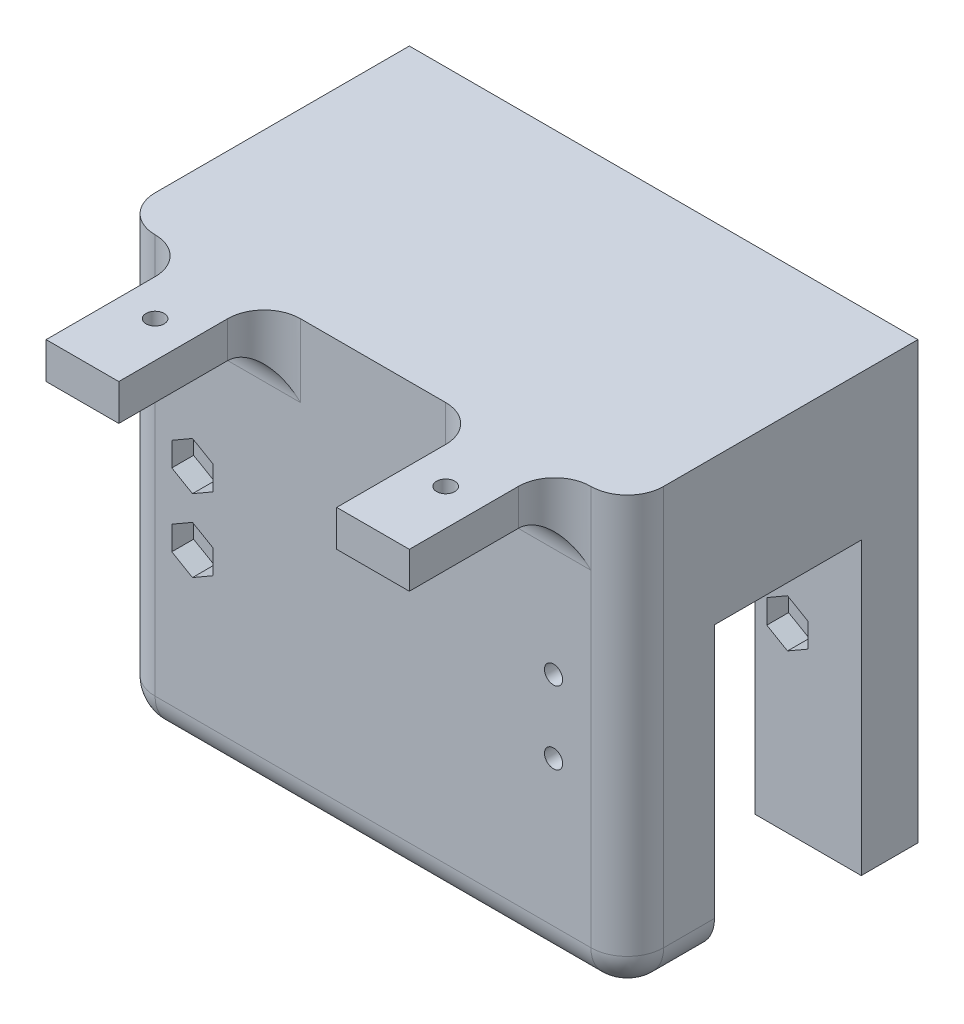
from build123d import *

# Parameters (mm, degrees)
SKETCH_2_W           = 70
SKETCH_2_H           = 60
EXTRUDE_2_DEPTH      = 40
SKETCH_3_W           = 40.7
SKETCH_3_H           = 20.5
CUT_EXTRUDE_1_DEPTH  = 28
SKETCH_4_W           = 14.65
SKETCH_4_H           = 20.5
EXTRUDE_3_DEPTH      = 28
SKETCH_8_W           = 10
SKETCH_8_H           = 5
EXTRUDE_5_DEPTH      = 60
SKETCH_15_W          = 40.7
SKETCH_15_H          = 40.25
CUT_EXTRUDE_6_DEPTH  = 28
SKETCH_16_W          = 14.65
SKETCH_16_H          = 20.204149113
CUT_EXTRUDE_7_DEPTH  = 40
M3X0_5_1_D           = 2.5
FILLET_1_R           = 5
FILLET_2_R           = 5
FILLET_3_R           = 5
M3X0_5_2_D           = 2.5
CUT_EXTRUDE_8_DEPTH  = 3
CUT_EXTRUDE_9_DEPTH  = 3
CUT_EXTRUDE_10_DEPTH = 6


# Some blends are built 0.0001 mm under size
with BuildPart() as part:
    # ｽｹｯﾁ2 → ﾎﾞｽ - 押し出し2 (new body)
    with BuildSketch(Plane.XY):
        Rectangle(SKETCH_2_W, SKETCH_2_H)
    extrude(amount=EXTRUDE_2_DEPTH)

    # ｽｹｯﾁ3 → ｶｯﾄ - 押し出し1 (cut)
    with BuildSketch(Plane.XY):
        Rectangle(SKETCH_3_W, SKETCH_3_H)
    extrude(amount=CUT_EXTRUDE_1_DEPTH, mode=Mode.SUBTRACT)

    # ｽｹｯﾁ4 → ﾎﾞｽ - 押し出し3 (add)
    with BuildSketch(Plane.XY):
        with Locations((27.675, 0)):
            Rectangle(SKETCH_4_W, SKETCH_4_H)
    extrude(amount=EXTRUDE_3_DEPTH)

    # ｽｹｯﾁ8 → ﾎﾞｽ - 押し出し5 (add)
    with BuildSketch(Plane.XY):
        with Locations((-20, 27.5)):
            Rectangle(SKETCH_8_W, SKETCH_8_H)
        with Locations((20, 27.5)):
            Rectangle(SKETCH_8_W, SKETCH_8_H)
    extrude(amount=EXTRUDE_5_DEPTH)

    # ｽｹｯﾁ15 → ｶｯﾄ - 押し出し6 (cut)
    with BuildSketch(Plane.XY):
        with Locations((0, -9.875)):
            Rectangle(SKETCH_15_W, SKETCH_15_H)
    extrude(amount=CUT_EXTRUDE_6_DEPTH, mode=Mode.SUBTRACT)

    # ｽｹｯﾁ16 → ｶｯﾄ - 押し出し7 (cut)
    with BuildSketch(Plane(origin=(0, -30, 0), x_dir=(-1, 0, 0), z_dir=(0, -1, 0))):
        with Locations((-27.675, -17.897925444)):
            Rectangle(SKETCH_16_W, SKETCH_16_H)
    extrude(amount=-CUT_EXTRUDE_7_DEPTH, mode=Mode.SUBTRACT)

    # M3x0.5 ねじ穴1 (through all)
    with Locations(Plane(origin=(0, 30, 0), x_dir=(1, 0, 0), z_dir=(0, 1, 0))):
        with Locations((-20, -50), (20, -50)):
            Hole(M3X0_5_1_D / 2)

    # ﾌｨﾚｯﾄ1
    fillet_1_edges = [part.edges().sort_by_distance(p)[0] for p in [
        (-15, 27.5, 40),
        (-20, 25, 40),
        (-25, 27.5, 40),
        (20, 25, 40),
        (15, 27.5, 40),
        (25, 27.5, 40),
    ]]
    fillet(fillet_1_edges, radius=FILLET_1_R)

    # ﾌｨﾚｯﾄ2
    fillet_2_edges = [part.edges().sort_by_distance(p)[0] for p in [
        (35, 0, 40),
        (35, -30, 34),
        (0, -30, 40),
        (-35, 0, 40),
    ]]
    fillet(fillet_2_edges, radius=FILLET_2_R - 0.0001)  # a hair under: the kernel refuses the full size

    # ﾌｨﾚｯﾄ3
    # the kernel refuses this fillet: 5 mm, written as the material it takes off along each edge
    with BuildSketch(Plane(origin=(-30, -25, 40), x_dir=(-1, 0, 0), z_dir=(0, 1, 0))) as fillet_3_piece_1:
        with BuildLine():
            CenterArc((0.0001, -4.9999), 4.9999, 0, 90)
            Line((5, -4.9999), (5, 0))
            Line((5, 0), (0.0001, 0))
        make_face()
    revolve(axis=Axis((-30, -25, 40), (0, 0, 1)), revolution_arc=90, mode=Mode.SUBTRACT)
    with BuildSketch(Plane(origin=(-35, -30, -12.5), x_dir=(0, 1, 0), z_dir=(0, 0, 1))) as fillet_3_piece_2:
        with BuildLine():
            CenterArc((FILLET_3_R, -FILLET_3_R), FILLET_3_R, 90, 90)
            Line((0, -FILLET_3_R), (0, 0))
            Line((0, 0), (FILLET_3_R, 0))
        make_face()
    extrude(amount=52.5, mode=Mode.SUBTRACT)

    # M3x0.5 ねじ穴2 (through all)
    with Locations(Plane(origin=(0, 0, 0), x_dir=(-1, 0, 0), z_dir=(0, 0, -1))):
        with Locations((24.85, 5), (24.85, -5)):
            m3x0_5_2 = Hole(M3X0_5_2_D / 2)

    # ﾐﾗｰ1: M3x0.5 ねじ穴2 across plane
    add(m3x0_5_2.mirror(Plane(origin=(0, 0, 0), x_dir=(0, 0, 1), z_dir=(1, 0, 0))), mode=Mode.SUBTRACT)

    # ｽｹｯﾁ17 → ｶｯﾄ - 押し出し8 (cut)
    with BuildSketch(Plane.XY.offset(40)):
        Polygon((-24.85, 8.290896534), (-27.7, 6.645448267), (-27.7, 3.354551733), (-24.85, 1.709103466), (-22, 3.354551733), (-22, 6.645448267), align=None)
        Polygon((-22, -6.645448267), (-22, -3.354551733), (-24.85, -1.709103466), (-27.7, -3.354551733), (-27.7, -6.645448267), (-24.85, -8.290896534), align=None)
    extrude(amount=-CUT_EXTRUDE_8_DEPTH, mode=Mode.SUBTRACT)

    # ｽｹｯﾁ18 → ｶｯﾄ - 押し出し9 (cut)
    with BuildSketch(Plane.XY.offset(7.795850887)):
        Polygon((27.7, 3.354551733), (27.7, 6.645448267), (24.85, 8.290896534), (22, 6.645448267), (22, 3.354551733), (24.85, 1.709103466), align=None)
        Polygon((27.7, -6.645448267), (27.7, -3.354551733), (24.85, -1.709103466), (22, -3.354551733), (22, -6.645448267), (24.85, -8.290896534), align=None)
    extrude(amount=-CUT_EXTRUDE_9_DEPTH, mode=Mode.SUBTRACT)

    # ｽｹｯﾁ19 → ｶｯﾄ - 押し出し10 (cut)
    with BuildSketch(Plane(origin=(0, 0, 20), x_dir=(-1, 0, 0), z_dir=(0, 0, -1))):
        Polygon((35, 1.709103466), (35, 8.290896534), (24.85, 8.290896534), (27.7, 6.645448267), (27.7, 3.354551733), (24.85, 1.709103466), align=None)
        Polygon((22, 6.645448267), (22, 3.354551733), (24.85, 1.709103466), (27.7, 3.354551733), (27.7, 6.645448267), (24.85, 8.290896534), align=None)
        Polygon((22, -6.645448267), (24.85, -8.290896534), (27.7, -6.645448267), (27.7, -3.354551733), (24.85, -1.709103466), (22, -3.354551733), align=None)
        Polygon((35, -8.290896534), (24.85, -8.290896534), (27.7, -6.645448267), (27.7, -3.354551733), (24.85, -1.709103466), (35, -1.709103466), align=None)
    extrude(amount=-CUT_EXTRUDE_10_DEPTH, mode=Mode.SUBTRACT)


solid = part.part
